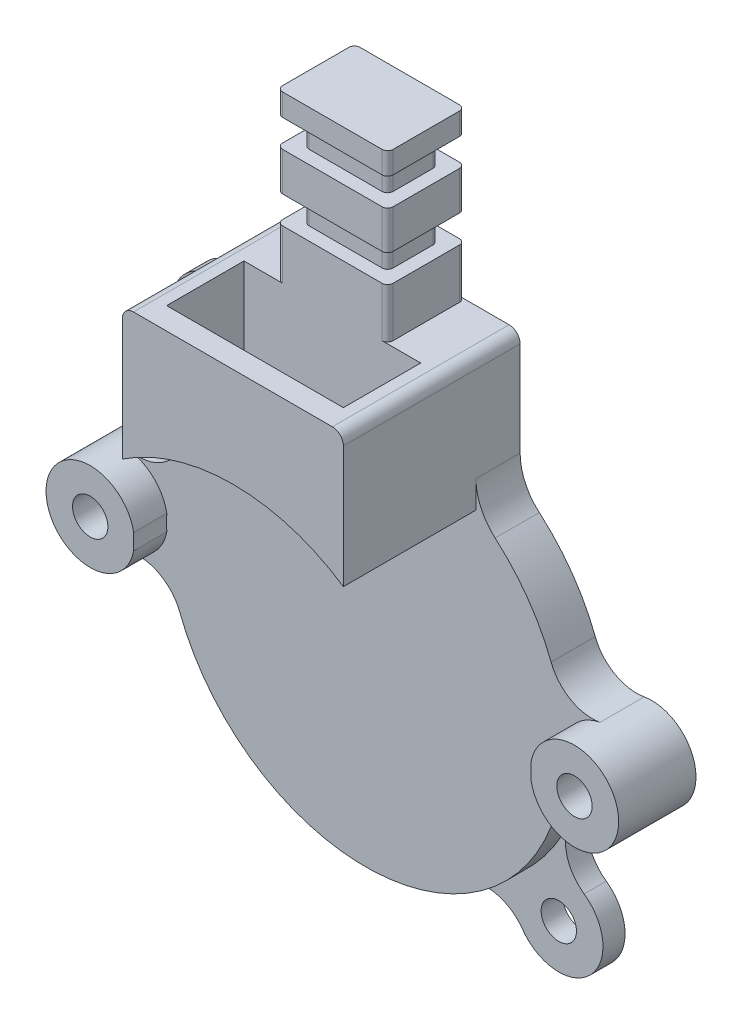
from build123d import *

# Parameters (mm, degrees)
SKETCH_1_R                = 1.6
EXTRUDE_1_DEPTH           = 2
EXTRUDE_START             = 2
EXTRUDE_2_OUTLINE_R       = 1.6
EXTRUDE_2_DEPTH           = 2
EXTRUDE_START_2           = 4
SKETCH_1_4_R              = 1.6
EXTRUDE_3_DEPTH           = 3
FILLET_2_DEPTH            = 4
FILLET_2_2_DEPTH          = 2
FILLET_3_DEPTH            = 2
EXTRUDE_4_DEPTH           = 7
EXTRUDE_5_DEPTH           = 2
SKETCH_4_W                = 10
SKETCH_4_H                = 15
EXTRUDE_6_DEPTH           = 7
CUT_EXTRUDE_START         = -2
SKETCH_5_W                = 10
SKETCH_5_H                = 7
SKETCH_5_W_2              = 7.6
SKETCH_5_H_2              = 4.6
CUT_EXTRUDE_1_DEPTH       = 2.5
CUT_EXTRUDE_START_2       = -5
CUT_EXTRUDE_2_OUTLINE_W   = 2.5
CUT_EXTRUDE_2_OUTLINE_H   = 1.2
CUT_EXTRUDE_2_DEPTH       = 10
CUT_EXTRUDE_2_2_OUTLINE_W = 2.5
CUT_EXTRUDE_2_2_OUTLINE_H = 4.6
CUT_EXTRUDE_2_2_DEPTH     = 1.2
CUT_EXTRUDE_START_3       = 3.8
CUT_EXTRUDE_2_3_OUTLINE_W = 2.5
CUT_EXTRUDE_2_3_OUTLINE_H = 4.6
CUT_EXTRUDE_2_3_DEPTH     = 1.2
FILLET_4_R                = 5
FILLET_5_R                = 1
FILLET_6_R                = 0.5
SKETCH_6_R                = 2.1
CUT_EXTRUDE_3_DEPTH       = 4


with BuildPart() as part:
    # Эскиз1 → Бобышка-Вытянуть1 (new body)
    with BuildSketch(Plane.XY):
        with BuildLine():
            ThreePointArc((12.207759872, -13.227645252), (18.328207768, -18.328207768), (13.227645252, -12.207759872))
            ThreePointArc((13.227645252, -12.207759872), (16.629831585, -6.888301783), (17.985547445, -0.721167868))
            ThreePointArc((17.985547445, -0.721167868), (25.92, 0), (17.985547445, 0.721167868))
            ThreePointArc((17.985547445, 0.721167868), (15.70130603, 8.801646945), (10, 14.966629547))
            Line((10, 14.966629547), (10, 27))
            Line((10, 27), (-10, 27))
            Line((-10, 27), (-10, 14.966629547))
            ThreePointArc((-10, 14.966629547), (-11.137870812, 14.140291149), (-12.207759872, 13.227645252))
            ThreePointArc((-12.207759872, 13.227645252), (-18.328207768, 18.328207768), (-13.227645252, 12.207759872))
            ThreePointArc((-13.227645252, 12.207759872), (-16.629831585, 6.888301783), (-17.985547445, 0.721167868))
            ThreePointArc((-17.985547445, 0.721167868), (-25.92, 0), (-17.985547445, -0.721167868))
            ThreePointArc((-17.985547445, -0.721167868), (-6.888301783, -16.629831585), (12.207759872, -13.227645252))
        make_face()
        with Locations((15.499780644, -15.499780644)):
            Circle(SKETCH_1_R, mode=Mode.SUBTRACT)
        with Locations((-21.92, 0)):
            Circle(SKETCH_1_R, mode=Mode.SUBTRACT)
        with Locations((21.92, 0)):
            Circle(SKETCH_1_R, mode=Mode.SUBTRACT)
        with Locations((-15.499780644, 15.499780644)):
            Circle(SKETCH_1_R, mode=Mode.SUBTRACT)
    extrude(amount=EXTRUDE_1_DEPTH)

    # Бобышка-Вытянуть2: read off the stored shape, not the designer's step
    # Бобышка-Вытянуть2 outline → Бобышка-Вытянуть2 (add)
    with BuildSketch(Plane.XY.offset(EXTRUDE_START)):
        with BuildLine():
            ThreePointArc((17.985547445, -0.721167868), (25.92, 0), (17.985547445, 0.721167868))
            ThreePointArc((17.985547445, 0.721167868), (15.70130603, 8.801646944), (10, 14.966629547))
            Line((10, 14.966629547), (10, 27))
            Line((10, 27), (-10, 27))
            Line((-10, 27), (-10, 14.966629547))
            ThreePointArc((-10, 14.966629547), (-15.70130603, 8.801646944), (-17.985547445, 0.721167868))
            ThreePointArc((-17.985547445, 0.721167868), (-25.92, 0), (-17.985547445, -0.721167868))
            ThreePointArc((-17.985547445, -0.721167868), (0, -18), (17.985547445, -0.721167868))
        make_face()
        with Locations((-21.92, 0)):
            Circle(EXTRUDE_2_OUTLINE_R, mode=Mode.SUBTRACT)
        with Locations((21.92, 0)):
            Circle(EXTRUDE_2_OUTLINE_R, mode=Mode.SUBTRACT)
    extrude(amount=EXTRUDE_2_DEPTH)

    # Эскиз1<4> → Бобышка-Вытянуть3 (add)
    # profile 1 of 3: a face of its own
    with BuildSketch(Plane.XY.offset(EXTRUDE_START_2)):
        with BuildLine():
            ThreePointArc((17.985547445, 0.721167868), (17.996386499, 0.360656336), (18, 0))
            ThreePointArc((18, 0), (17.996386499, -0.360656336), (17.985547445, -0.721167868))
            ThreePointArc((17.985547445, -0.721167868), (25.92, 0), (17.985547445, 0.721167868))
        make_face()
        with Locations((21.92, 0)):
            Circle(SKETCH_1_4_R, mode=Mode.SUBTRACT)
    # profile 2 of 3: a face of its own
    with BuildSketch(Plane.XY.offset(EXTRUDE_START_2)):
        with BuildLine():
            ThreePointArc((-10, 14.966629547), (0, 18), (10, 14.966629547))
            Line((10, 14.966629547), (10, 27))
            Line((10, 27), (-10, 27))
            Line((-10, 27), (-10, 14.966629547))
        make_face()
    # profile 3 of 3: a face of its own
    with BuildSketch(Plane.XY.offset(EXTRUDE_START_2)):
        with BuildLine():
            ThreePointArc((-17.985547445, -0.721167868), (-17.996386499, -0.360656336), (-18, 0))
            ThreePointArc((-18, 0), (-17.996386499, 0.360656336), (-17.985547445, 0.721167868))
            ThreePointArc((-17.985547445, 0.721167868), (-25.92, 0), (-17.985547445, -0.721167868))
        make_face()
        with Locations((-21.92, 0)):
            Circle(SKETCH_1_4_R, mode=Mode.SUBTRACT)
    extrude(amount=EXTRUDE_3_DEPTH)

    # Скругление2: read off the stored shape, not the designer's step
    # Скругление2 outline → Скругление2 (add)
    with BuildSketch(Plane.XY):
        with BuildLine():
            ThreePointArc((-16.805693431, 6.447376855), (-18.568168191, 4.400080171), (-21.230145985, 3.940063634))
            ThreePointArc((-21.230145985, 3.940063634), (-19.102842691, 2.839652215), (-17.985547445, 0.721167868))
            ThreePointArc((-17.985547445, 0.721167868), (-17.629661873, 3.632495318), (-16.805693431, 6.447376855))
        make_face()
        with BuildLine():
            ThreePointArc((-21.230145985, -3.940063634), (-18.568168191, -4.400080171), (-16.805693431, -6.447376855))
            ThreePointArc((-16.805693431, -6.447376855), (-17.629661873, -3.632495318), (-17.985547445, -0.721167868))
            ThreePointArc((-17.985547445, -0.721167868), (-19.102842691, -2.839652215), (-21.230145985, -3.940063634))
        make_face()
        with BuildLine():
            ThreePointArc((17.985547445, 0.721167868), (19.102842691, 2.839652215), (21.230145985, 3.940063634))
            ThreePointArc((21.230145985, 3.940063634), (18.568168191, 4.400080171), (16.805693431, 6.447376855))
            ThreePointArc((16.805693431, 6.447376855), (17.629661873, 3.632495318), (17.985547445, 0.721167868))
        make_face()
        with BuildLine():
            ThreePointArc((17.985547445, -0.721167868), (17.629661873, -3.632495318), (16.805693431, -6.447376855))
            ThreePointArc((16.805693431, -6.447376855), (18.568168191, -4.400080171), (21.230145985, -3.940063634))
            ThreePointArc((21.230145985, -3.940063634), (19.102842691, -2.839652215), (17.985547445, -0.721167868))
        make_face()
    extrude(amount=FILLET_2_DEPTH)

    # Fillet 2 2 outline → Fillet 2 2 (add)
    with BuildSketch(Plane.XY):
        with BuildLine():
            ThreePointArc((-17.798025906, 12.225934478), (-16.241004168, 10.018351115), (-16.442403683, 7.324435892))
            ThreePointArc((-16.442403683, 7.324435892), (-15.034615533, 9.897491388), (-13.227645252, 12.207759872))
            ThreePointArc((-13.227645252, 12.207759872), (-15.515686945, 11.49981227), (-17.798025906, 12.225934478))
        make_face()
        with BuildLine():
            ThreePointArc((7.324435892, -16.442403683), (10.018351115, -16.241004168), (12.225934478, -17.798025906))
            ThreePointArc((12.225934478, -17.798025906), (11.49981227, -15.515686945), (12.207759872, -13.227645252))
            ThreePointArc((12.207759872, -13.227645252), (9.897491388, -15.034615533), (7.324435892, -16.442403683))
        make_face()
        with BuildLine():
            ThreePointArc((13.227645252, -12.207759872), (15.515686945, -11.49981227), (17.798025906, -12.225934478))
            ThreePointArc((17.798025906, -12.225934478), (16.241004168, -10.018351115), (16.442403683, -7.324435892))
            ThreePointArc((16.442403683, -7.324435892), (15.034615533, -9.897491388), (13.227645252, -12.207759872))
        make_face()
    extrude(amount=FILLET_2_2_DEPTH)

    # Скругление3: read off the stored shape, not the designer's step
    # Скругление3 outline → Скругление3 (add)
    with BuildSketch(Plane.XY):
        with BuildLine():
            Line((-10, 14.966629547), (-10, 17.679682972))
            ThreePointArc((-10, 17.679682972), (-10.776344158, 16.70501479), (-11.899956129, 17.243702506))
            ThreePointArc((-11.899956129, 17.243702506), (-11.511477517, 15.194104067), (-12.207759872, 13.227645252))
            ThreePointArc((-12.207759872, 13.227645252), (-11.137870812, 14.140291149), (-10, 14.966629547))
        make_face()
    extrude(amount=FILLET_3_DEPTH)

    # Эскиз2 → Бобышка-Вытянуть4 (add)
    with BuildSketch(Plane.XY.offset(7)):
        with BuildLine():
            Line((-10, 27), (-8, 27))
            Line((-8, 27), (-8, 16.124515497))
            ThreePointArc((-8, 16.124515497), (-9.018601608, 15.577702816), (-10, 14.966629547))
            Line((-10, 14.966629547), (-10, 27))
        make_face()
        with BuildLine():
            Line((10, 27), (8, 27))
            Line((8, 27), (8, 16.124515497))
            ThreePointArc((8, 16.124515497), (9.018601608, 15.577702816), (10, 14.966629547))
            Line((10, 14.966629547), (10, 27))
        make_face()
    extrude(amount=EXTRUDE_4_DEPTH)

    # Эскиз3 → Бобышка-Вытянуть5 (add)
    with BuildSketch(Plane.XY.offset(14)):
        with BuildLine():
            Line((10, 27), (-8, 27))
            Line((-8, 27), (-8, 16.124515497))
            ThreePointArc((-8, 16.124515497), (1.155497714, 17.962873518), (10, 14.966629547))
            Line((10, 14.966629547), (10, 27))
        make_face()
        with BuildLine():
            Line((-8, 27), (-10, 27))
            Line((-10, 27), (-10, 14.966629547))
            ThreePointArc((-10, 14.966629547), (-9.018601608, 15.577702816), (-8, 16.124515497))
            Line((-8, 16.124515497), (-8, 27))
        make_face()
    extrude(amount=EXTRUDE_5_DEPTH)

    # Эскиз4 → Бобышка-Вытянуть6 (add)
    with BuildSketch(Plane(origin=(0, 0, 0), x_dir=(-1, 0, 0), z_dir=(0, 0, -1))):
        with Locations((0, 34.5)):
            Rectangle(SKETCH_4_W, SKETCH_4_H)
    extrude(amount=-EXTRUDE_6_DEPTH)

    # Эскиз5 → Вырез-Вытянуть1 (cut)
    with BuildSketch(Plane(origin=(0, 42, 0), x_dir=(1, 0, 0), z_dir=(0, 1, 0)).offset(CUT_EXTRUDE_START)):
        with Locations((0, -3.5)):
            Rectangle(SKETCH_5_W, SKETCH_5_H)
        with Locations((0, -3.5)):
            Rectangle(SKETCH_5_W_2, SKETCH_5_H_2, mode=Mode.SUBTRACT)
    extrude(amount=-CUT_EXTRUDE_1_DEPTH, mode=Mode.SUBTRACT)

    # Вырез-Вытянуть2: read off the stored shape, not the designer's step
    # Вырез-Вытянуть2 outline → Вырез-Вытянуть2 (cut)
    with BuildSketch(Plane.YZ.offset(CUT_EXTRUDE_START_2)):
        with Locations((32.75, 6.4)):
            Rectangle(CUT_EXTRUDE_2_OUTLINE_W, CUT_EXTRUDE_2_OUTLINE_H)
        with Locations((32.75, 0.6)):
            Rectangle(CUT_EXTRUDE_2_OUTLINE_W, CUT_EXTRUDE_2_OUTLINE_H)
    extrude(amount=CUT_EXTRUDE_2_DEPTH, mode=Mode.SUBTRACT)

    # Cut-Extrude 2 2 outline → Cut-Extrude 2 2 (cut)
    with BuildSketch(Plane.YZ.offset(CUT_EXTRUDE_START_2)):
        with Locations((32.75, 3.5)):
            Rectangle(CUT_EXTRUDE_2_2_OUTLINE_W, CUT_EXTRUDE_2_2_OUTLINE_H)
    extrude(amount=CUT_EXTRUDE_2_2_DEPTH, mode=Mode.SUBTRACT)

    # Cut-Extrude 2 3 outline → Cut-Extrude 2 3 (cut)
    with BuildSketch(Plane.YZ.offset(CUT_EXTRUDE_START_3)):
        with Locations((32.75, 3.5)):
            Rectangle(CUT_EXTRUDE_2_3_OUTLINE_W, CUT_EXTRUDE_2_3_OUTLINE_H)
    extrude(amount=CUT_EXTRUDE_2_3_DEPTH, mode=Mode.SUBTRACT)

    # Скругление4
    fillet_4_edges = [part.edges().sort_by_distance(p)[0] for p in [
        (10, 14.966629547, 1),
    ]]
    fillet(fillet_4_edges, radius=FILLET_4_R)

    # Скругление5
    fillet_5_edges = [part.edges().sort_by_distance(p)[0] for p in [
        (-10, 14.966629547, 3),
        (-10, 27, 8),
        (10, 27, 8),
    ]]
    fillet(fillet_5_edges, radius=FILLET_5_R)

    # Скругление6
    fillet_6_edges = [part.edges().sort_by_distance(p)[0] for p in [
        (5, 41, 0),
        (-5, 29.25, 0),
        (-5, 29.25, 7),
        (5, 41, 7),
        (5, 35.75, 7),
        (5, 35.75, 0),
        (-5, 41, 7),
        (-5, 41, 0),
        (3.8, 38.75, 5.8),
        (-3.8, 38.75, 5.8),
        (-3.8, 38.75, 1.2),
        (3.8, 38.75, 1.2),
        (5, 29.25, 0),
        (5, 29.25, 7),
        (-5, 35.75, 7),
        (-5, 35.75, 0),
        (3.8, 32.75, 5.8),
        (-3.8, 32.75, 5.8),
        (-3.8, 32.75, 1.2),
        (3.8, 32.75, 1.2),
    ]]
    fillet(fillet_6_edges, radius=FILLET_6_R)

    # Эскиз6 → Вырез-Вытянуть3 (cut)
    with BuildSketch(Plane(origin=(0, 0, 0), x_dir=(-1, 0, 0), z_dir=(0, 0, -1))):
        with Locations((-21.92, 0)):
            Circle(SKETCH_6_R)
        with Locations((21.92, 0)):
            Circle(SKETCH_6_R)
    extrude(amount=-CUT_EXTRUDE_3_DEPTH, mode=Mode.SUBTRACT)


solid = part.part
